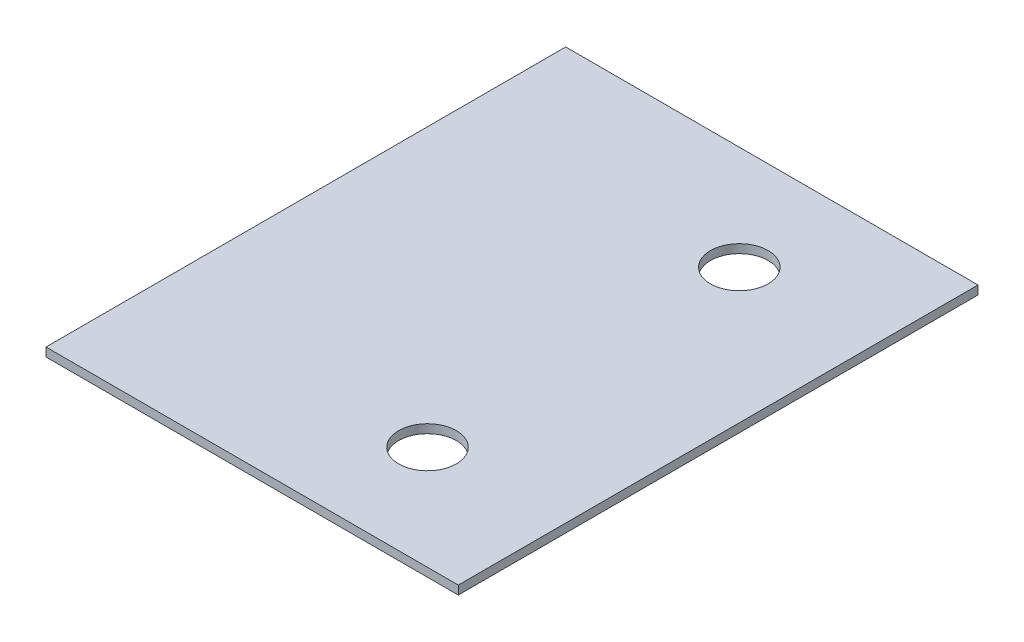
from build123d import *

# Parameters (mm, degrees)
SKETCH1_W           = 23.8
SKETCH1_H           = 30
BOSS_EXTRUDE1_DEPTH = 0.5
CUT_EXTRUDE1_REACH  = 21.154
SKETCH2_R           = 1.665


with BuildPart() as part:
    # Sketch1 → Boss-Extrude1 (new body)
    with BuildSketch(Plane(origin=(0, 0, 0), x_dir=(1, 0, 0), z_dir=(0, 1, 0))):
        Rectangle(SKETCH1_W, SKETCH1_H)
    extrude(amount=BOSS_EXTRUDE1_DEPTH)

    # Sketch2 → Cut-Extrude1 (cut, up to next)
    with BuildSketch(Plane(origin=(0, 0.5, 0), x_dir=(1, 0, 0), z_dir=(0, 1, 0)), mode=Mode.PRIVATE) as cut_extrude1_sk1:
        with Locations((4.121380866, 9)):
            Circle(SKETCH2_R)
    cut_extrude1_tool1 = extrude(cut_extrude1_sk1.sketch, amount=-CUT_EXTRUDE1_REACH, mode=Mode.PRIVATE) & part.part
    # Sketch2 → Cut-Extrude1 (cut, up to next)
    with BuildSketch(Plane(origin=(0, 0.5, 0), x_dir=(1, 0, 0), z_dir=(0, 1, 0)), mode=Mode.PRIVATE) as cut_extrude1_sk2:
        with Locations((4.121380866, -9)):
            Circle(SKETCH2_R)
    cut_extrude1_tool2 = extrude(cut_extrude1_sk2.sketch, amount=-CUT_EXTRUDE1_REACH, mode=Mode.PRIVATE) & part.part
    add(cut_extrude1_tool1.solids().sort_by_distance((4.121381, 0.5, -9))[0], mode=Mode.SUBTRACT)
    add(cut_extrude1_tool2.solids().sort_by_distance((4.121381, 0.5, 9))[0], mode=Mode.SUBTRACT)


solid = part.part
